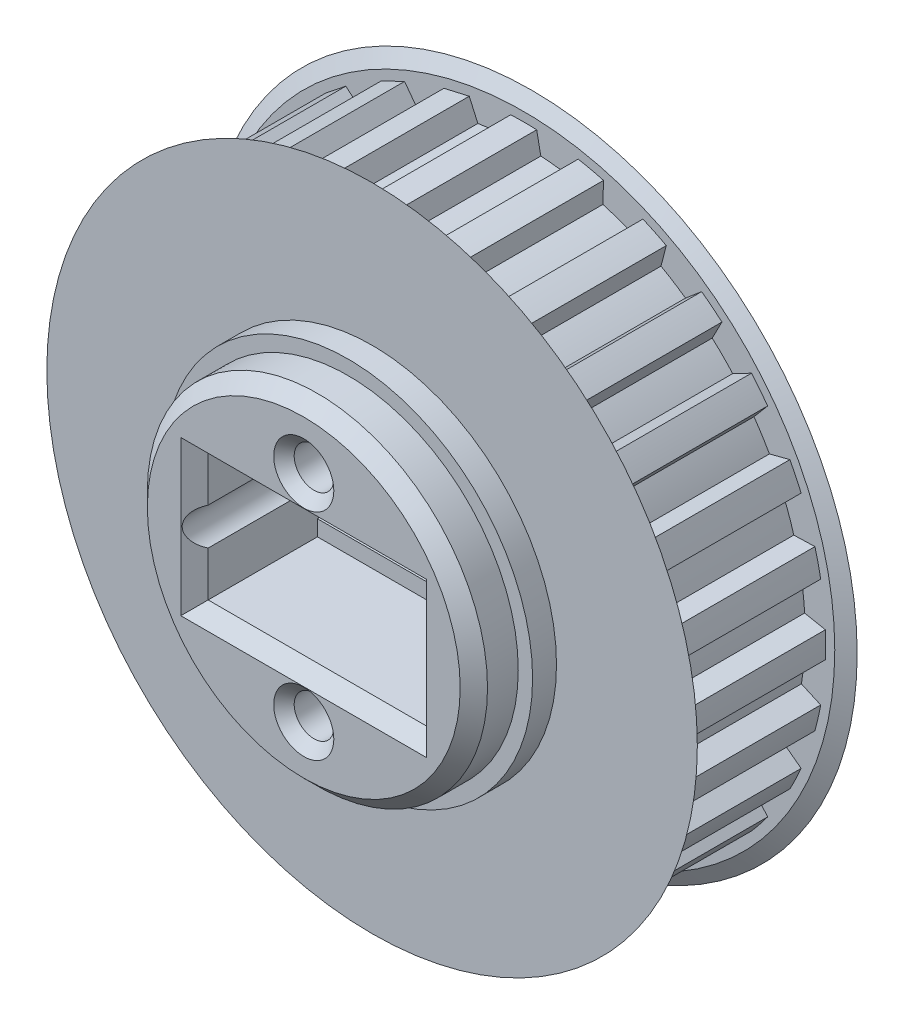
from build123d import *

# Parameters (mm, degrees)
CROQUIS1_R                 = 1.5
SALIENTE_EXTRUIR1_DEPTH    = 10.5
CROQUIS2_R                 = 24.5
CROQUIS2_R_2               = 1.5
SALIENTE_EXTRUIR2_DEPTH    = 0.6
SALIENTE_EXTRUIR4_START    = 5
CROQUIS4_R                 = 12.45
CROQUIS4_R_2               = 1.5
SALIENTE_EXTRUIR4_DEPTH    = 5
SALIENTE_EXTRUIR6_START    = 0.6
CROQUIS6_R                 = 24.5
CROQUIS6_R_2               = 1.5
SALIENTE_EXTRUIR6_DEPTH    = 0.6
SALIENTE_EXTRUIR5_START    = 1.9
CROQUIS5_R                 = 13.5
CROQUIS5_R_2               = 1.5
SALIENTE_EXTRUIR5_DEPTH    = 1.9
CHAFL_N2_SIZE              = 1.732050808
CHAFL_N2_SIZE_2            = 1
CROQUIS3_R                 = 12.45
CROQUIS3_R_2               = 1.5
SALIENTE_EXTRUIR7_DEPTH    = 5
CHAFL_N4_SIZE              = 1
CROQUIS7_R                 = 13.5
CROQUIS7_R_2               = 1.5
SALIENTE_EXTRUIR8_DEPTH    = 1.75
CORTAR_EXTRUIR1_DEPTH      = 38.319882212
CORTAR_EXTRUIR1_DEPTH_BACK = 38.319882212
CROQUIS8_R                 = 1.45
CROQUIS8_W                 = 16
CROQUIS8_H                 = 7
CROQUIS10_W                = 16
CROQUIS10_H                = 9.3
CORTAR_EXTRUIR3_DEPTH      = 9
CHAFL_N5_SIZE              = 1
SKETCH1_R                  = 12.45
SKETCH1_R_2                = 1.45
BOSS_EXTRUDE1_DEPTH        = 5
SKETCH2_R                  = 1.45
CUT_EXTRUDE1_DEPTH         = 40.733784219
SKETCH4_W                  = 8
SKETCH4_H                  = 7
CUT_EXTRUDE2_DEPTH         = 30
CHAMFER3_SIZE              = 1
CHAMFER2_SIZE              = 0.75
CHAMFER4_SIZE              = 0.75


# Some blends are built 0.0001 mm under size
with BuildPart() as part:
    # Croquis1 → Saliente-Extruir1 (new body)
    with BuildSketch(Plane.XY):
        with BuildLine():
            Line((-0.95, 22.079572007), (-1.25, 20.562040268))
            ThreePointArc((-1.25, 20.562040268), (-2.306468208, 20.470471524), (-3.356824514, 20.324658157))
            Line((-3.356824514, 20.324658157), (-3.986985468, 21.737385926))
            Line((-3.986985468, 21.737385926), (-5.839348501, 21.314596151))
            Line((-5.839348501, 21.314596151), (-5.794144295, 19.768355822))
            ThreePointArc((-5.794144295, 19.768355822), (-6.803748676, 19.443996604), (-7.795323831, 19.068112816))
            Line((-7.795323831, 19.068112816), (-8.724046836, 20.305196547))
            Line((-8.724046836, 20.305196547), (-10.435887685, 19.480817443))
            Line((-10.435887685, 19.480817443), (-10.047746, 17.983403469))
            ThreePointArc((-10.047746, 17.983403469), (-10.959860776, 17.442518504), (-11.84293306, 16.855412678))
            Line((-11.84293306, 16.855412678), (-13.023648067, 17.854819826))
            Line((-13.023648067, 17.854819826), (-14.509127884, 16.670189203))
            Line((-14.509127884, 16.670189203), (-13.797511766, 15.296688173))
            ThreePointArc((-13.797511766, 15.296688173), (-14.566399692, 14.566399692), (-15.296688173, 13.797511766))
            Line((-15.296688173, 13.797511766), (-16.670189203, 14.509127884))
            ThreePointArc((-16.670189203, 14.509127884), (-17.278475763, 13.779124621), (-17.854819826, 13.023648067))
            Line((-17.854819826, 13.023648067), (-16.855412678, 11.84293306))
            ThreePointArc((-16.855412678, 11.84293306), (-17.442518504, 10.959860776), (-17.983403469, 10.047746))
            Line((-17.983403469, 10.047746), (-19.480817443, 10.435887685))
            ThreePointArc((-19.480817443, 10.435887685), (-19.911411981, 9.588830634), (-20.305196547, 8.724046836))
            Line((-20.305196547, 8.724046836), (-19.068112816, 7.795323831))
            ThreePointArc((-19.068112816, 7.795323831), (-19.443996604, 6.803748676), (-19.768355822, 5.794144295))
            Line((-19.768355822, 5.794144295), (-21.314596151, 5.839348501))
            ThreePointArc((-21.314596151, 5.839348501), (-21.545906859, 4.91771264), (-21.737385926, 3.986985468))
            Line((-21.737385926, 3.986985468), (-20.324658157, 3.356824514))
            ThreePointArc((-20.324658157, 3.356824514), (-20.470471524, 2.306468208), (-20.562040268, 1.25))
            Line((-20.562040268, 1.25), (-22.079572007, 0.95))
            ThreePointArc((-22.079572007, 0.95), (-22.1, 0), (-22.079572007, -0.95))
            Line((-22.079572007, -0.95), (-20.562040268, -1.25))
            ThreePointArc((-20.562040268, -1.25), (-20.470471524, -2.306468208), (-20.324658157, -3.356824514))
            Line((-20.324658157, -3.356824514), (-21.737385926, -3.986985468))
            ThreePointArc((-21.737385926, -3.986985468), (-21.545906859, -4.91771264), (-21.314596151, -5.839348501))
            Line((-21.314596151, -5.839348501), (-19.768355822, -5.794144295))
            ThreePointArc((-19.768355822, -5.794144295), (-19.443996604, -6.803748676), (-19.068112816, -7.795323831))
            Line((-19.068112816, -7.795323831), (-20.305196547, -8.724046836))
            ThreePointArc((-20.305196547, -8.724046836), (-19.911411981, -9.588830634), (-19.480817443, -10.435887685))
            Line((-19.480817443, -10.435887685), (-17.983403469, -10.047746))
            ThreePointArc((-17.983403469, -10.047746), (-17.442518504, -10.959860776), (-16.855412678, -11.84293306))
            Line((-16.855412678, -11.84293306), (-17.854819826, -13.023648067))
            ThreePointArc((-17.854819826, -13.023648067), (-17.278475763, -13.779124621), (-16.670189203, -14.509127884))
            Line((-16.670189203, -14.509127884), (-15.296688173, -13.797511766))
            ThreePointArc((-15.296688173, -13.797511766), (-14.566399692, -14.566399692), (-13.797511766, -15.296688173))
            Line((-13.797511766, -15.296688173), (-14.509127884, -16.670189203))
            ThreePointArc((-14.509127884, -16.670189203), (-13.779124621, -17.278475763), (-13.023648067, -17.854819826))
            Line((-13.023648067, -17.854819826), (-11.84293306, -16.855412678))
            ThreePointArc((-11.84293306, -16.855412678), (-10.959860776, -17.442518504), (-10.047746, -17.983403469))
            Line((-10.047746, -17.983403469), (-10.435887685, -19.480817443))
            ThreePointArc((-10.435887685, -19.480817443), (-9.588830634, -19.911411981), (-8.724046836, -20.305196547))
            Line((-8.724046836, -20.305196547), (-7.795323831, -19.068112816))
            ThreePointArc((-7.795323831, -19.068112816), (-6.803748676, -19.443996604), (-5.794144295, -19.768355822))
            Line((-5.794144295, -19.768355822), (-5.839348501, -21.314596151))
            ThreePointArc((-5.839348501, -21.314596151), (-4.91771264, -21.545906859), (-3.986985468, -21.737385926))
            Line((-3.986985468, -21.737385926), (-3.356824514, -20.324658157))
            ThreePointArc((-3.356824514, -20.324658157), (-2.306468208, -20.470471524), (-1.25, -20.562040268))
            Line((-1.25, -20.562040268), (-0.95, -22.079572007))
            ThreePointArc((-0.95, -22.079572007), (0, -22.1), (0.95, -22.079572007))
            Line((0.95, -22.079572007), (1.25, -20.562040268))
            ThreePointArc((1.25, -20.562040268), (2.306468208, -20.470471524), (3.356824514, -20.324658157))
            Line((3.356824514, -20.324658157), (3.986985468, -21.737385926))
            ThreePointArc((3.986985468, -21.737385926), (4.91771264, -21.545906859), (5.839348501, -21.314596151))
            Line((5.839348501, -21.314596151), (5.794144295, -19.768355822))
            ThreePointArc((5.794144295, -19.768355822), (6.803748676, -19.443996604), (7.795323831, -19.068112816))
            Line((7.795323831, -19.068112816), (8.724046836, -20.305196547))
            ThreePointArc((8.724046836, -20.305196547), (9.588830634, -19.911411981), (10.435887685, -19.480817443))
            Line((10.435887685, -19.480817443), (10.047746, -17.983403469))
            ThreePointArc((10.047746, -17.983403469), (10.959860776, -17.442518504), (11.84293306, -16.855412678))
            Line((11.84293306, -16.855412678), (13.023648067, -17.854819826))
            ThreePointArc((13.023648067, -17.854819826), (13.779124621, -17.278475763), (14.509127884, -16.670189203))
            Line((14.509127884, -16.670189203), (13.797511766, -15.296688173))
            ThreePointArc((13.797511766, -15.296688173), (14.566399692, -14.566399692), (15.296688173, -13.797511766))
            Line((15.296688173, -13.797511766), (16.670189203, -14.509127884))
            ThreePointArc((16.670189203, -14.509127884), (17.278475763, -13.779124621), (17.854819826, -13.023648067))
            Line((17.854819826, -13.023648067), (16.855412678, -11.84293306))
            ThreePointArc((16.855412678, -11.84293306), (17.442518504, -10.959860776), (17.983403469, -10.047746))
            Line((17.983403469, -10.047746), (19.480817443, -10.435887685))
            ThreePointArc((19.480817443, -10.435887685), (19.911411981, -9.588830634), (20.305196547, -8.724046836))
            Line((20.305196547, -8.724046836), (19.068112816, -7.795323831))
            ThreePointArc((19.068112816, -7.795323831), (19.443996604, -6.803748676), (19.768355822, -5.794144295))
            Line((19.768355822, -5.794144295), (21.314596151, -5.839348501))
            ThreePointArc((21.314596151, -5.839348501), (21.545906859, -4.91771264), (21.737385926, -3.986985468))
            Line((21.737385926, -3.986985468), (20.324658157, -3.356824514))
            ThreePointArc((20.324658157, -3.356824514), (20.470471524, -2.306468208), (20.562040268, -1.25))
            Line((20.562040268, -1.25), (22.079572007, -0.95))
            ThreePointArc((22.079572007, -0.95), (22.1, 0), (22.079572007, 0.95))
            Line((22.079572007, 0.95), (20.562040268, 1.25))
            ThreePointArc((20.562040268, 1.25), (20.470471524, 2.306468208), (20.324658157, 3.356824514))
            Line((20.324658157, 3.356824514), (21.737385926, 3.986985468))
            ThreePointArc((21.737385926, 3.986985468), (21.545906859, 4.91771264), (21.314596151, 5.839348501))
            Line((21.314596151, 5.839348501), (19.768355822, 5.794144295))
            ThreePointArc((19.768355822, 5.794144295), (19.443996604, 6.803748676), (19.068112816, 7.795323831))
            Line((19.068112816, 7.795323831), (20.305196547, 8.724046836))
            ThreePointArc((20.305196547, 8.724046836), (19.911411981, 9.588830634), (19.480817443, 10.435887685))
            Line((19.480817443, 10.435887685), (17.983403469, 10.047746))
            ThreePointArc((17.983403469, 10.047746), (17.442518504, 10.959860776), (16.855412678, 11.84293306))
            Line((16.855412678, 11.84293306), (17.854819826, 13.023648067))
            ThreePointArc((17.854819826, 13.023648067), (17.278475763, 13.779124621), (16.670189203, 14.509127884))
            Line((16.670189203, 14.509127884), (15.296688173, 13.797511766))
            ThreePointArc((15.296688173, 13.797511766), (14.566399692, 14.566399692), (13.797511766, 15.296688173))
            Line((13.797511766, 15.296688173), (14.509127884, 16.670189203))
            ThreePointArc((14.509127884, 16.670189203), (13.779124621, 17.278475763), (13.023648067, 17.854819826))
            Line((13.023648067, 17.854819826), (11.84293306, 16.855412678))
            ThreePointArc((11.84293306, 16.855412678), (10.959860776, 17.442518504), (10.047746, 17.983403469))
            Line((10.047746, 17.983403469), (10.435887685, 19.480817443))
            ThreePointArc((10.435887685, 19.480817443), (9.588830634, 19.911411981), (8.724046836, 20.305196547))
            Line((8.724046836, 20.305196547), (7.795323831, 19.068112816))
            ThreePointArc((7.795323831, 19.068112816), (6.803748676, 19.443996604), (5.794144295, 19.768355822))
            Line((5.794144295, 19.768355822), (5.839348501, 21.314596151))
            ThreePointArc((5.839348501, 21.314596151), (4.91771264, 21.545906859), (3.986985468, 21.737385926))
            Line((3.986985468, 21.737385926), (3.356824514, 20.324658157))
            ThreePointArc((3.356824514, 20.324658157), (2.306468208, 20.470471524), (1.25, 20.562040268))
            Line((1.25, 20.562040268), (0.95, 22.079572007))
            ThreePointArc((0.95, 22.079572007), (0, 22.1), (-0.95, 22.079572007))
        make_face()
        with Locations(Location((0, 0, 0), (0, 0, 180))):
            Circle(CROQUIS1_R, mode=Mode.SUBTRACT)
    extrude(amount=SALIENTE_EXTRUIR1_DEPTH)

    # Croquis2 → Saliente-Extruir2 (add)
    with BuildSketch(Plane.XY.offset(10.5)):
        Circle(CROQUIS2_R)
        with Locations(Location((0, 0, 0), (0, 0, 180))):
            Circle(CROQUIS2_R_2, mode=Mode.SUBTRACT)
    extrude(amount=SALIENTE_EXTRUIR2_DEPTH)

    # Croquis4 → Saliente-Extruir4 (add)
    with BuildSketch(Plane(origin=(0, 0, 0), x_dir=(-1, 0, 0), z_dir=(0, 0, -1)).offset(SALIENTE_EXTRUIR4_START)):
        with Locations(Location((0, 0, 0), (0, 0, 180))):
            Circle(CROQUIS4_R)
        Circle(CROQUIS4_R_2, mode=Mode.SUBTRACT)
    extrude(amount=-SALIENTE_EXTRUIR4_DEPTH)

    # Croquis6 → Saliente-Extruir6 (add)
    with BuildSketch(Plane(origin=(0, 0, 0), x_dir=(-1, 0, 0), z_dir=(0, 0, -1)).offset(SALIENTE_EXTRUIR6_START)):
        with Locations(Location((0, 0, 0), (0, 0, 180))):
            Circle(CROQUIS6_R)
        Circle(CROQUIS6_R_2, mode=Mode.SUBTRACT)
    extrude(amount=-SALIENTE_EXTRUIR6_DEPTH)

    # Croquis5 → Saliente-Extruir5 (add)
    with BuildSketch(Plane(origin=(0, 0, -0.6), x_dir=(-1, 0, 0), z_dir=(0, 0, -1)).offset(SALIENTE_EXTRUIR5_START)):
        with Locations(Location((0, 0, 0), (0, 0, 180))):
            Circle(CROQUIS5_R)
        Circle(CROQUIS5_R_2, mode=Mode.SUBTRACT)
    extrude(amount=-SALIENTE_EXTRUIR5_DEPTH)

    # Chaflán2
    # the kernel refuses this chamfer: 1.732050808, 1 mm, written as the material it takes off along each edge
    with BuildSketch(Plane(origin=(0, 0, 0), x_dir=(1, 0, 0), z_dir=(0, 1, 0))) as chafl_n2_piece_1:
        Polygon((24.5 - CHAFL_N2_SIZE, 0), (24.5, CHAFL_N2_SIZE_2), (24.5, 0), align=None)
    revolve(axis=Axis((0, 0, 0), (0, 0, -1)), mode=Mode.SUBTRACT)
    with BuildSketch(Plane(origin=(0, 0, 10.5), x_dir=(1, 0, 0), z_dir=(0, -1, 0))) as chafl_n2_piece_2:
        Polygon((24.5 - CHAFL_N2_SIZE, 0), (24.5, CHAFL_N2_SIZE_2), (24.5, 0), align=None)
    revolve(axis=Axis((0, 0, 10.5), (0, 0, 1)), mode=Mode.SUBTRACT)

    # Croquis3 → Saliente-Extruir7 (add)
    with BuildSketch(Plane.XY.offset(11.1)):
        with Locations(Location((0, 0, 0), (0, 0, 180))):
            Circle(CROQUIS3_R)
        with Locations(Location((0, 0, 0), (0, 0, 180))):
            Circle(CROQUIS3_R_2, mode=Mode.SUBTRACT)
    extrude(amount=SALIENTE_EXTRUIR7_DEPTH)

    # Chaflán4
    chafl_n4_edges = [part.edges().sort_by_distance(p)[0] for p in [
        (12.45, 0, 16.1),
    ]]
    chamfer(chafl_n4_edges, length=CHAFL_N4_SIZE)

    # Croquis7 → Saliente-Extruir8 (add)
    with BuildSketch(Plane.XY.offset(11.1)):
        Circle(CROQUIS7_R)
        with Locations(Location((0, 0, 0), (0, 0, 180))):
            Circle(CROQUIS7_R_2, mode=Mode.SUBTRACT)
    extrude(amount=SALIENTE_EXTRUIR8_DEPTH)

    # Croquis8 → Cortar-Extruir1 (cut, two sides: drawn at the far end of the back side and taken through both)
    with BuildSketch(Plane.XY.offset(-CORTAR_EXTRUIR1_DEPTH_BACK)):
        with Locations((0, 7.875631857)):
            Circle(CROQUIS8_R)
        with Locations((0, -7.875631857)):
            Circle(CROQUIS8_R)
        Rectangle(CROQUIS8_W, CROQUIS8_H)
    extrude(amount=CORTAR_EXTRUIR1_DEPTH + CORTAR_EXTRUIR1_DEPTH_BACK, mode=Mode.SUBTRACT)

    # Croquis10 → Cortar-Extruir3 (cut)
    with BuildSketch(Plane.XY.offset(16.1)):
        Rectangle(CROQUIS10_W, CROQUIS10_H)
    extrude(amount=-CORTAR_EXTRUIR3_DEPTH, mode=Mode.SUBTRACT)

    # Chaflán5
    chafl_n5_edges = [part.edges().sort_by_distance(p)[0] for p in [
        (8, 0, -5),
        (0, -3.5, -5),
        (-8, 0, -5),
        (0, 3.5, -5),
        (8, 0, 16.1),
        (-8, 0, 16.1),
        (0, -4.65, 16.1),
        (0, 4.65, 16.1),
    ]]
    chamfer(chafl_n5_edges, length=CHAFL_N5_SIZE)

    # Sketch1 → Boss-Extrude1 (add)
    with BuildSketch(Plane(origin=(0, 0, -5), x_dir=(-1, 0, 0), z_dir=(0, 0, -1))):
        Circle(SKETCH1_R)
        with Locations(Location((0, 7.875631857, 0), (0, 0, 180))):
            Circle(SKETCH1_R_2, mode=Mode.SUBTRACT)
        with Locations(Location((0, -7.875631857, 0), (0, 0, 180))):
            Circle(SKETCH1_R_2, mode=Mode.SUBTRACT)
    extrude(amount=-BOSS_EXTRUDE1_DEPTH)

    # Sketch2 → Cut-Extrude1 (cut, through all)
    with BuildSketch(Plane(origin=(0, 0, -5), x_dir=(-1, 0, 0), z_dir=(0, 0, -1))):
        with Locations((-7.5, 0)):
            Circle(SKETCH2_R)
        with Locations(Location((7.5, 0, 0), (0, 0, 69.828728654))):
            Circle(SKETCH2_R)
    extrude(amount=-CUT_EXTRUDE1_DEPTH, mode=Mode.SUBTRACT)

    # Sketch4 → Cut-Extrude2 (cut)
    with BuildSketch(Plane.XY.offset(16.1)):
        Rectangle(SKETCH4_W, SKETCH4_H)
    extrude(amount=-CUT_EXTRUDE2_DEPTH, mode=Mode.SUBTRACT)

    # Chamfer3
    chamfer3_edges = [part.edges().sort_by_distance(p)[0] for p in [
        (-4, 0, -5),
        (0, 3.5, -5),
        (4, 0, -5),
        (0, -3.5, -5),
    ]]
    chamfer(chamfer3_edges, length=CHAMFER3_SIZE - 0.0001)  # a hair under: the kernel refuses the full size

    # Chamfer2
    chamfer2_edges = [part.edges().sort_by_distance(p)[0] for p in [
        (-12.45, 0, -5),
    ]]
    chamfer(chamfer2_edges, length=CHAMFER2_SIZE)

    # Chamfer4
    chamfer4_edges = [part.edges().sort_by_distance(p)[0] for p in [
        (-1.45, -7.875631857, 16.1),
        (-1.45, 7.875631857, 16.1),
        (8.95, 0, -5),
        (-7, -1.361065759, -5),
    ]]
    chamfer(chamfer4_edges, length=CHAMFER4_SIZE)


solid = part.part
